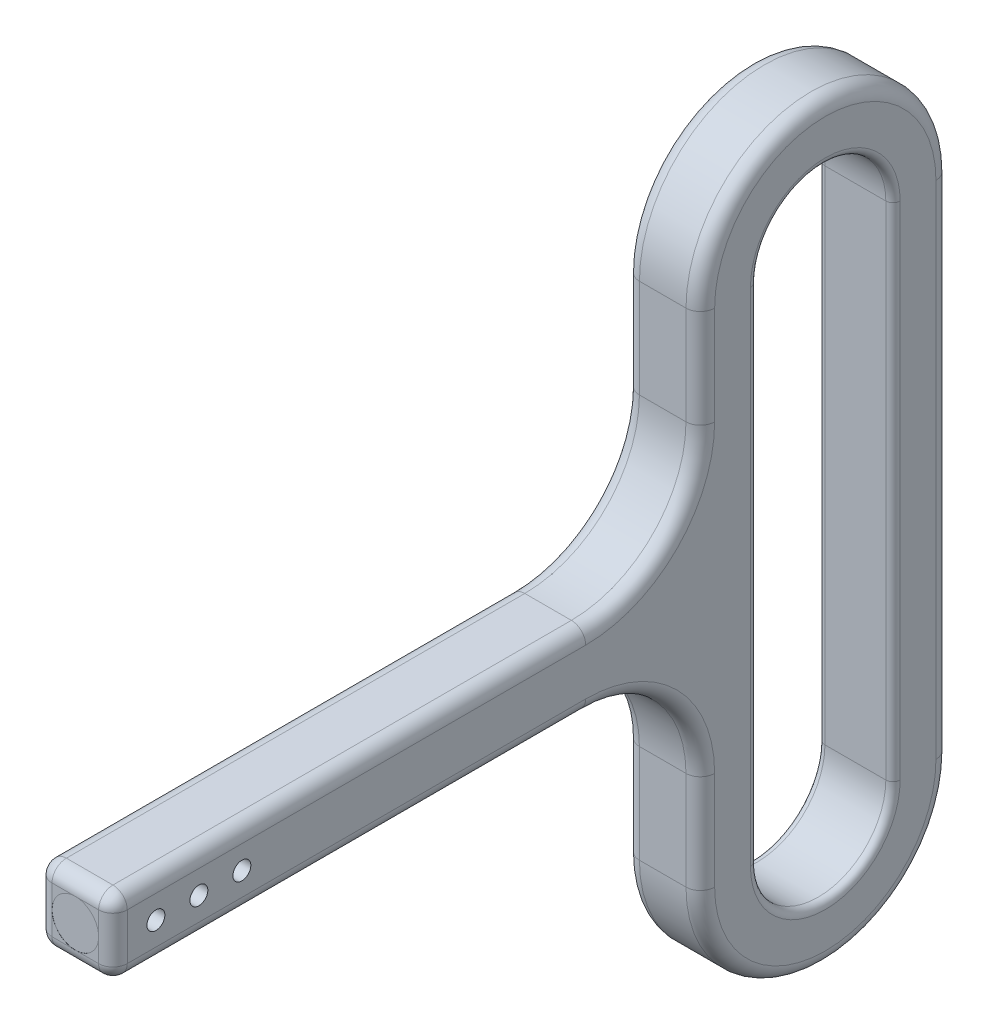
from build123d import *

# Parameters (mm, degrees)
SKETCH2_R           = 1.5875
BOSS_EXTRUDE2_DEPTH = 13.335
FILLET4_R           = 2.54
FILLET2_R           = 20.32
FILLET1_R           = 2.54
FILLET3_R           = 1.27
SKETCH7_R           = 4.1275
CUT_EXTRUDE6_DEPTH  = 0.0127


with BuildPart() as part:
    # Sketch2 → Boss-Extrude2 (new body)
    with BuildSketch(Plane(origin=(0, 0, 0), x_dir=(0, 0, -1), z_dir=(1, 0, 0))):
        with BuildLine():
            Line((-22.16, -6.6675), (-22.16, -44.45))
            ThreePointArc((-22.16, -44.45), (0, -66.61), (22.16, -44.45))
            Line((22.16, -44.45), (22.16, 44.45))
            ThreePointArc((22.16, 44.45), (0, 66.61), (-22.16, 44.45))
            Line((-22.16, 44.45), (-22.16, 6.6675))
            Line((-22.16, 6.6675), (-126.3, 6.6675))
            Line((-126.3, 6.6675), (-126.3, -6.6675))
            Line((-126.3, -6.6675), (-22.16, -6.6675))
        make_face()
        with BuildLine():
            ThreePointArc((12, -44.45), (0, -56.45), (-12, -44.45))
            Line((-12, -44.45), (-12, 44.45))
            ThreePointArc((-12, 44.45), (0, 56.45), (12, 44.45))
            Line((12, 44.45), (12, -44.45))
        make_face(mode=Mode.SUBTRACT)
        with Locations((-111.06, 0)):
            Circle(SKETCH2_R, mode=Mode.SUBTRACT)
        with Locations((-103.44, 0)):
            Circle(SKETCH2_R, mode=Mode.SUBTRACT)
        with Locations((-118.68, 0)):
            Circle(SKETCH2_R, mode=Mode.SUBTRACT)
    extrude(amount=BOSS_EXTRUDE2_DEPTH)

    # Fillet4
    fillet4_edges = [part.edges().sort_by_distance(p)[0] for p in [
        (6.6675, -6.6675, 126.3),
        (6.6675, 6.6675, 126.3),
    ]]
    fillet(fillet4_edges, radius=FILLET4_R)

    # Fillet2
    fillet2_edges = [part.edges().sort_by_distance(p)[0] for p in [
        (6.6675, -6.6675, 22.16),
        (6.6675, 6.6675, 22.16),
    ]]
    fillet(fillet2_edges, radius=FILLET2_R)

    # Fillet1
    fillet1_edges = [part.edges().sort_by_distance(p)[0] for p in [
        (13.335, 6.6675, 83.12),
        (0, 6.6675, 83.12),
        (13.335, -6.6675, 83.12),
        (0, -6.6675, 83.12),
        (13.335, 35.71875, 22.16),
        (13.335, 66.61, 0),
        (13.335, 0, -22.16),
        (13.335, -66.61, 0),
        (0, 35.71875, 22.16),
        (0, 66.61, 0),
        (0, 0, -22.16),
        (0, -66.61, 0),
        (13.335, -35.71875, 22.16),
        (0, -35.71875, 22.16),
        (13.335, 12.619090206, 28.111590206),
        (13.335, -12.619090206, 28.111590206),
        (0, 12.619090206, 28.111590206),
        (0, -12.619090206, 28.111590206),
        (13.335, 5.923551224, 125.556051224),
        (13.335, 0, 126.3),
        (13.335, -5.923551224, 125.556051224),
        (0, 5.923551224, 125.556051224),
        (0, 0, 126.3),
        (0, -5.923551224, 125.556051224),
    ]]
    fillet(fillet1_edges, radius=FILLET1_R)

    # Fillet3
    fillet3_edges = [part.edges().sort_by_distance(p)[0] for p in [
        (0, -56.45, 0),
        (0, 0, -12),
        (0, 56.45, 0),
        (13.335, -56.45, 0),
        (13.335, 0, -12),
        (13.335, 56.45, 0),
        (0, 0, 12),
        (13.335, 0, 12),
    ]]
    fillet(fillet3_edges, radius=FILLET3_R)

    # Sketch7 → Cut-Extrude6 (cut)
    with BuildSketch(Plane.XY.offset(126.3)):
        with Locations((6.6675, 0)):
            Circle(SKETCH7_R)
    extrude(amount=-CUT_EXTRUDE6_DEPTH, mode=Mode.SUBTRACT)


solid = part.part
